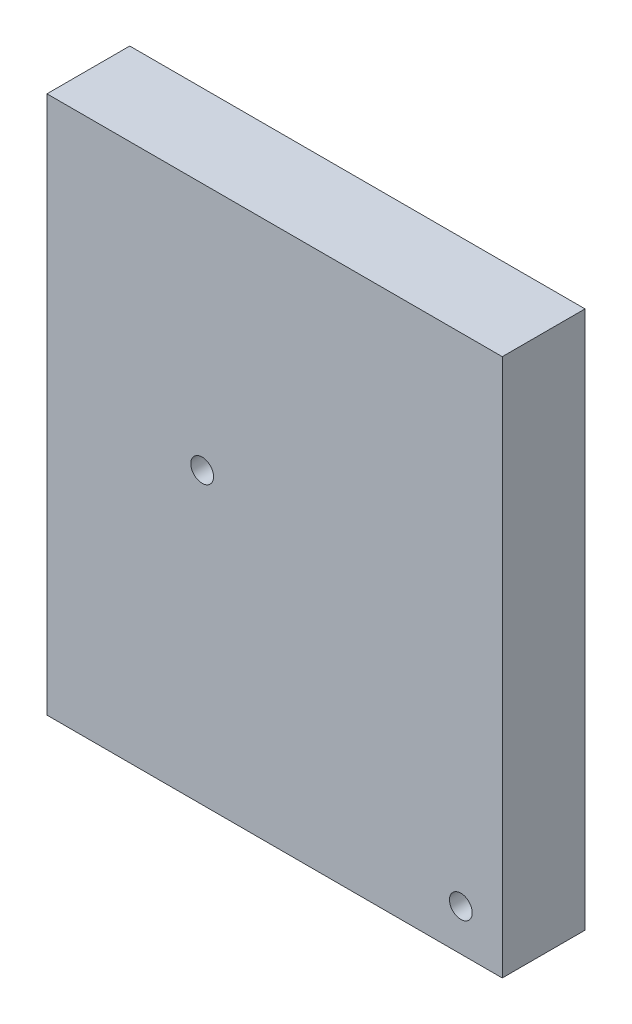
from build123d import *

# Parameters (mm, degrees)
SKETCH1_W           = 55.88
SKETCH1_H           = 66.04
SKETCH1_R           = 1.397
BOSS_EXTRUDE1_DEPTH = 10.16


with BuildPart() as part:
    # Sketch1 → Boss-Extrude1 (new body)
    with BuildSketch(Plane.XY):
        Rectangle(SKETCH1_W, SKETCH1_H)
        with Locations((-8.89, 2.54)):
            Circle(SKETCH1_R, mode=Mode.SUBTRACT)
        with Locations((22.86, -27.94)):
            Circle(SKETCH1_R, mode=Mode.SUBTRACT)
    extrude(amount=BOSS_EXTRUDE1_DEPTH)


solid = part.part
